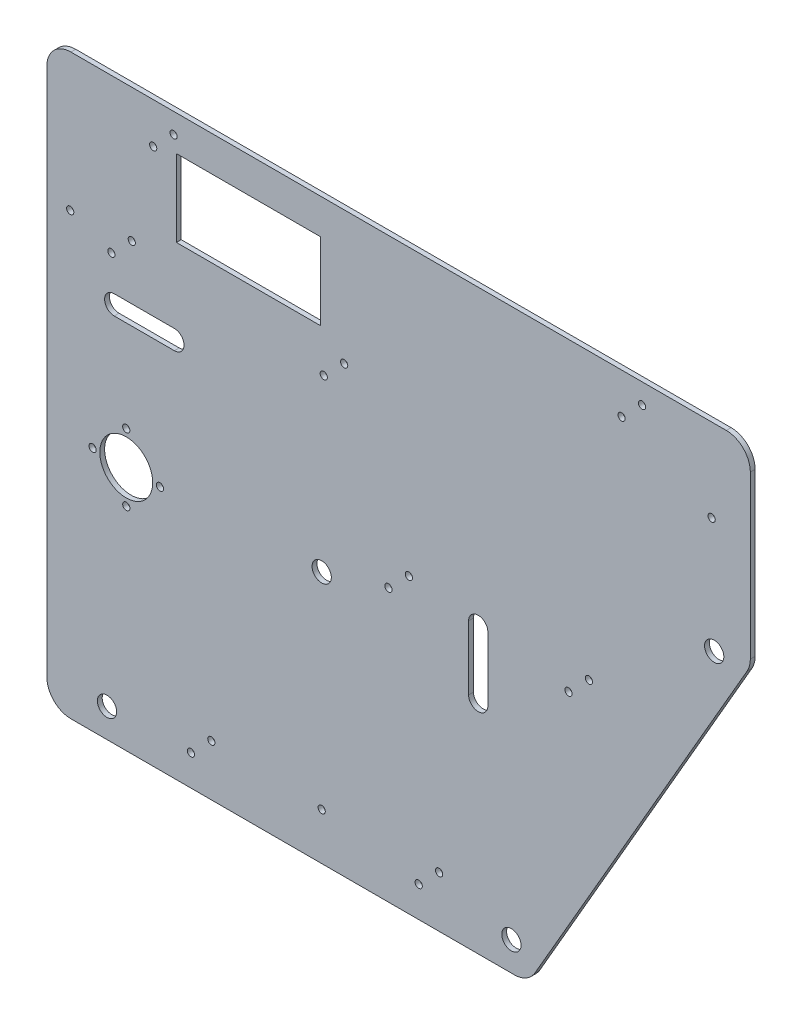
from build123d import *

# Parameters (mm, degrees)
BOSS_EXTRUDE1_DEPTH = 2
SKETCH2_R           = 4
SKETCH2_R_2         = 11
SKETCH2_R_3         = 1.5
CUT_EXTRUDE1_DEPTH  = 3
SKETCH4_W           = 292.37604307
SKETCH4_H           = 50
BOSS_EXTRUDE2_DEPTH = 2
FILLET1_R           = 10
SKETCH5_R           = 1.5
SKETCH5_W           = 60
SKETCH5_H           = 32
CUT_EXTRUDE2_DEPTH  = 11


with BuildPart() as part:
    # Sketch1 → Boss-Extrude1 (new body)
    with BuildSketch(Plane.XY):
        Polygon((-100, 110), (-100, -80), (100, -80), (192.37604307, 80), (192.37604307, 110), align=None)
    extrude(amount=BOSS_EXTRUDE1_DEPTH)

    # Sketch2 → Cut-Extrude1 (cut)
    with BuildSketch(Plane.XY.offset(2)):
        with Locations((93.07179677, -68)):
            Circle(SKETCH2_R)
        with Locations((177.364936071, 78)):
            Circle(SKETCH2_R)
        with Locations((-67, 22)):
            Circle(SKETCH2_R_2)
        with Locations((-75, -68)):
            Circle(SKETCH2_R)
        with Locations((-53, 22)):
            Circle(SKETCH2_R_3)
        with Locations((-67, 36)):
            Circle(SKETCH2_R_3)
        with Locations((-81, 22)):
            Circle(SKETCH2_R_3)
        with Locations((-67, 8)):
            Circle(SKETCH2_R_3)
        with Locations((54.54952947, -67.242640687)):
            Circle(SKETCH2_R_3)
        with Locations((63.034810844, -58.757359313)):
            Circle(SKETCH2_R_3)
        with Locations((14.225855729, -60.5)):
            Circle(SKETCH2_R_3)
        with Locations((-40.127135228, -67.242640687)):
            Circle(SKETCH2_R_3)
        with Locations((-31.641853854, -58.757359313)):
            Circle(SKETCH2_R_3)
        with Locations((-90.295627115, 102.881439108)):
            Circle(SKETCH2_R_3)
        with Locations((-73.186266887, 96.138798421)):
            Circle(SKETCH2_R_3)
        with Locations((-64.700985513, 104.624079796)):
            Circle(SKETCH2_R_3)
        with Locations((15.078196993, 96.138798421)):
            Circle(SKETCH2_R_3)
        with Locations((23.563478368, 104.624079796)):
            Circle(SKETCH2_R_3)
        with Locations((41.969500075, 33.138798421)):
            Circle(SKETCH2_R_3)
        with Locations((50.454781449, 41.624079796)):
            Circle(SKETCH2_R_3)
        with Locations((116.811272287, 33.138798421)):
            Circle(SKETCH2_R_3)
        with Locations((125.296553661, 41.624079796)):
            Circle(SKETCH2_R_3)
        with Locations((14.225855729, 25)):
            Circle(SKETCH2_R)
        with Locations((176.305585362, 125.488938255)):
            Circle(SKETCH2_R_3)
        with Locations((-55.814717647, 143.138798421)):
            Circle(SKETCH2_R_3)
        with Locations((-47.329436273, 151.624079796)):
            Circle(SKETCH2_R_3)
        with Locations((138.89162595, 143.138798421)):
            Circle(SKETCH2_R_3)
        with Locations((147.376907324, 151.624079796)):
            Circle(SKETCH2_R_3)
        with BuildLine():
            Line((75.290389443, 11.241781095), (75.290389443, 37.908558601))
            ThreePointArc((75.290389443, 37.908558601), (79.290389443, 41.908558601), (83.290389443, 37.908558601))
            Line((83.290389443, 37.908558601), (83.290389443, 11.241781095))
            ThreePointArc((83.290389443, 11.241781095), (79.290389443, 7.241781095), (75.290389443, 11.241781095))
        make_face()
        with BuildLine():
            Line((-72, 82), (-47, 82))
            ThreePointArc((-47, 82), (-43, 78), (-47, 74))
            Line((-47, 74), (-72, 74))
            ThreePointArc((-72, 74), (-76, 78), (-72, 82))
        make_face()
    extrude(amount=-CUT_EXTRUDE1_DEPTH, mode=Mode.SUBTRACT)

    # Sketch4 → Boss-Extrude2 (add)
    with BuildSketch(Plane.XY.offset(2)):
        with Locations((46.188021535, 135)):
            Rectangle(SKETCH4_W, SKETCH4_H)
    extrude(amount=-BOSS_EXTRUDE2_DEPTH)

    # Fillet1
    fillet1_edges = [part.edges().sort_by_distance(p)[0] for p in [
        (192.37604307, 160, 1),
        (192.37604307, 80, 1),
        (100, -80, 1),
        (-100, -80, 1),
        (-100, 160, 1),
    ]]
    fillet(fillet1_edges, radius=FILLET1_R)

    # Sketch5 → Cut-Extrude2 (cut)
    with BuildSketch(Plane.XY.offset(2)):
        with Locations((-55.814717647, 143.138798421)):
            Circle(SKETCH5_R)
        with Locations((-47.329436273, 151.624079796)):
            Circle(SKETCH5_R)
        with Locations((138.89162595, 143.138798421)):
            Circle(SKETCH5_R)
        with Locations((147.376907324, 151.624079796)):
            Circle(SKETCH5_R)
        with Locations((176.305585362, 125.488938255)):
            Circle(SKETCH5_R)
        with Locations((-16.178132997, 129.381439108)):
            Rectangle(SKETCH5_W, SKETCH5_H)
    extrude(amount=-CUT_EXTRUDE2_DEPTH, mode=Mode.SUBTRACT)


solid = part.part
